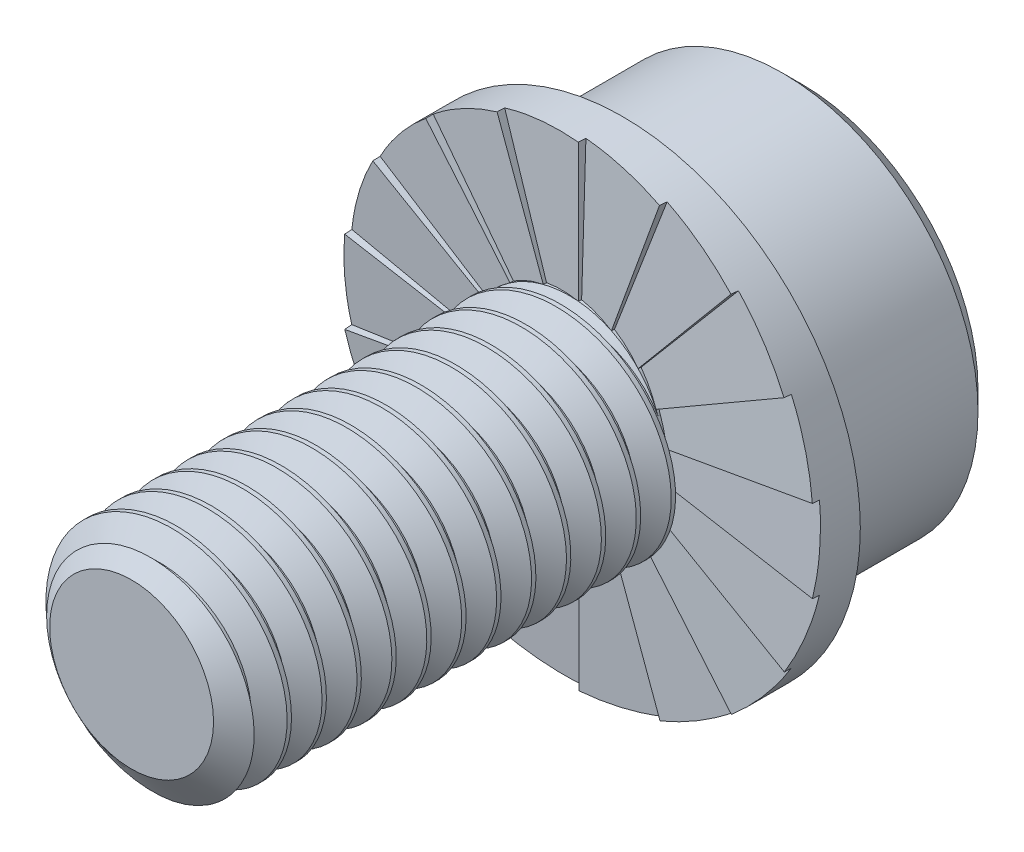
from build123d import *

# Parameters (mm, degrees)
SKETCH1_R           = 4
EXTRUDE1_DEPTH      = 16
CUT_SWEEP1_PITCH    = 1.25
SKETCH6_R           = 7
EXTRUDE2_DEPTH      = 8
SKETCH10_R          = 8.5
BOSS_EXTRUDE1_DEPTH = 1.5875
CUT_EXTRUDE5_DEPTH  = 1.5875
CIRPATTERN1_COUNT   = 18
BOSS_EXTRUDE2_REACH = 22.012
CUT_EXTRUDE1_DEPTH  = 4.5
CHAMFER1_SIZE       = 0.7
FILLET1_R           = 0.396875


with BuildPart() as part:
    # Sketch1 → Extrude1 (new body)
    with BuildSketch(Plane.XY):
        Circle(SKETCH1_R)
    extrude(amount=-EXTRUDE1_DEPTH)

    # Cut-Sweep1: arcs per turn and ends read off the stored shape
    # Cut-Sweep1: the profile of Sketch3 profile screwed along a right-hand helix through 15 turns, 6 arcs to a turn; built about Z, then put on its axis
    cut_sweep1_z = Axis((0, 0, 0), (0, 0, 1))
    cut_sweep1_corners = [(4.0003, 0, -2.343923205), (3.188101184, 0, -1.875), (3.188101184, 0, -1.71875), (4.0003, 0, -1.249826795)]
    with BuildLine(mode=Mode.PRIVATE) as cut_sweep1_profile:
        Line(cut_sweep1_corners[0], cut_sweep1_corners[1])
        Line(cut_sweep1_corners[1], cut_sweep1_corners[2])
        Line(cut_sweep1_corners[2], cut_sweep1_corners[3])
        Line(cut_sweep1_corners[3], cut_sweep1_corners[0])
    cut_sweep1_cap = Face(cut_sweep1_profile.wire())
    cut_sweep1_turn_angles = [0, 30, 60, 90, 120, 150, 180, 210, 240, 270, 300, 330, 360]
    cut_sweep1_turn_weights = [1, 0.8660254037844387, 1, 0.8660254037844387, 1, 0.8660254037844387, 1, 0.8660254037844387, 1, 0.8660254037844387, 1, 0.8660254037844387, 1]
    cut_sweep1_turn_rails = [Edge.make_bspline([Vector(p[0], p[1], 0).rotate(cut_sweep1_z, cut_sweep1_turn_angles[k]) / cut_sweep1_turn_weights[k] + Vector(0, 0, p[2] + CUT_SWEEP1_PITCH * cut_sweep1_turn_angles[k] / 360) for k in range(13)], [0, 0, 0, 1, 1, 2, 2, 3, 3, 4, 4, 5, 5, 6, 6, 6], 2, cut_sweep1_turn_weights) for p in cut_sweep1_corners]
    cut_sweep1_turn_sides = [Face.make_surface_from_curves(cut_sweep1_turn_rails[p[0]], cut_sweep1_turn_rails[p[1]]) for p in [(0, 1), (1, 2), (2, 3), (3, 0)]]
    cut_sweep1 = Plane(origin=(0, 0, 0), x_dir=(0, 1, 0), z_dir=(0, 0, -1)) * Solid(Shell([*[p.moved(Location((0, 0, CUT_SWEEP1_PITCH * i))) for i in range(15) for p in cut_sweep1_turn_sides], cut_sweep1_cap, cut_sweep1_cap.rotate(cut_sweep1_z, 5400).moved(Location((0, 0, CUT_SWEEP1_PITCH * 5400 / 360)))]))
    add(cut_sweep1, mode=Mode.SUBTRACT)

    # Sketch4 → Cut-Revolve1 (revolve, cut)
    with BuildSketch(Plane(origin=(0, 0, 0), x_dir=(0, 0, -1), z_dir=(1, 0, 0)), mode=Mode.PRIVATE) as cut_revolve1_sk:
        Polygon((0.746350386, 4), (0, 2.934101184), (0, 4), align=None)
    revolve(cut_revolve1_sk.sketch.rotate(Axis((0, 0, 0), (0, 0, -1)), 230.713364492), axis=Axis((0, 0, 0), (0, 0, -1)), mode=Mode.SUBTRACT)


with BuildPart() as body_2:
    # Sketch6 → Extrude2 (new body)
    with BuildSketch(Plane(origin=(0, 0, -16), x_dir=(-1, 0, 0), z_dir=(0, 0, -1))):
        Circle(SKETCH6_R)
    extrude(amount=EXTRUDE2_DEPTH)

    # Sketch10 → Boss-Extrude1 (add)
    with BuildSketch(Plane.XY.offset(-16)):
        Circle(SKETCH10_R)
    extrude(amount=-BOSS_EXTRUDE1_DEPTH)

    # Sketch19 → Cut-Extrude5 (cut)
    with BuildSketch(Plane(origin=(1.389185421, 0, -15.878462024), x_dir=(-0.996194698091745, 0, -0.08715574274766483), z_dir=(0.08715574274766483, 0, -0.996194698091745))):
        with BuildLine():
            Line((1.394491884, 0), (1.394491884, 11.040000007))
            add(Edge.make_bspline(
                [(5.169116445, 10.370695747), (4.642516462, 10.563598892), (4.104236344, 10.715035313), (2.848427134, 10.967069667), (2.117821205, 11.039743484), (1.397093721, 11.039999769), (1.395792795, 11.040000002), (1.394491884, 11.040000007)],
                knots=[0.444410142, 0.444410142, 0.444410142, 0.444410142, 0.46875, 0.46875, 0.5, 0.5, 0.500056509, 0.500056509, 0.500056509, 0.500056509], degree=3))
            Line((5.169116445, 10.370695747), (1.394491884, 0))
        make_face()
    cut_extrude5 = extrude(amount=-CUT_EXTRUDE5_DEPTH, mode=Mode.SUBTRACT)

    # CirPattern1: Cut-Extrude5 ×18 about axis
    cirpattern1_axis = Axis((0, 0, 0), (0, 0, 1))
    for i in range(1, CIRPATTERN1_COUNT):
        add(cut_extrude5.rotate(cirpattern1_axis, i * 360 / CIRPATTERN1_COUNT), mode=Mode.SUBTRACT)

    # Sketch20 → Boss-Extrude2 (add, up to next)
    with BuildSketch(Plane(origin=(0, 0, -16), x_dir=(-1, 0, 0), z_dir=(0, 0, -1)), mode=Mode.PRIVATE) as boss_extrude2_sk1:
        with BuildLine():
            ThreePointArc((-2.847065393, 1.434645533), (-3.177638958, 0.258069391), (-3.041254697, -0.956430355))
            add(Edge.make_bspline(
                [(-3.041254697, -0.956430355), (-2.970730657, -1.309523255), (-2.83931932, -1.640576819), (-2.474300515, -2.259017385), (-2.247579389, -2.534060866), (-1.710186248, -3.010190699), (-1.411500975, -3.201151408), (-0.754363806, -3.489195493), (-0.409717001, -3.579654897), (0.123707929, -3.634193731), (0.303842484, -3.639264675), (0.659211651, -3.624674227), (0.835785829, -3.604956129), (1.18669023, -3.540415306), (1.361621829, -3.495195087), (1.698890222, -3.382061839), (1.862514853, -3.314013764), (2.338473945, -3.075686223), (2.637192273, -2.86883457), (3.157505818, -2.38753983), (3.385122083, -2.106949834), (3.57211422, -1.8)],
                knots=[0, 0, 0, 0, 0.125, 0.125, 0.25, 0.25, 0.375, 0.375, 0.5, 0.5, 0.5625, 0.5625, 0.625, 0.625, 0.6875, 0.6875, 0.75, 0.75, 0.875, 0.875, 1, 1, 1, 1], degree=3))
            ThreePointArc((3.57211422, -1.8), (3.986873408, -0.323790715), (3.815756806, 1.2))
            add(Edge.make_bspline(
                [(3.815756806, 1.2), (3.678901358, 1.532429411), (3.503018702, 1.840471554), (3.177426395, 2.263937058), (3.057060422, 2.399221208), (2.801579734, 2.647845975), (2.66603619, 2.762054601), (2.236396381, 3.074887675), (1.914361266, 3.245148023), (1.4127593, 3.424055232), (1.241721069, 3.471673608), (0.891845206, 3.542486547), (0.712341619, 3.565505878), (0.356835675, 3.585368209), (0.17946694, 3.582590695), (-0.174508054, 3.551816681), (-0.352606652, 3.522119481), (-0.873898906, 3.391571193), (-1.200098871, 3.252587101), (-1.809137602, 2.868998374), (-2.07677962, 2.633562183), (-2.419742758, 2.218722745), (-2.523122594, 2.070988079), (-2.703861491, 1.763473952), (-2.782510923, 1.603061662), (-2.847065393, 1.434645533)],
                knots=[0, 0, 0, 0, 0.125, 0.125, 0.1875, 0.1875, 0.25, 0.25, 0.375, 0.375, 0.4375, 0.4375, 0.5, 0.5, 0.5625, 0.5625, 0.625, 0.625, 0.75, 0.75, 0.875, 0.875, 0.9375, 0.9375, 1, 1, 1, 1], degree=3))
        make_face()
    boss_extrude2_tool1 = extrude(boss_extrude2_sk1.sketch, amount=BOSS_EXTRUDE2_REACH, mode=Mode.PRIVATE) - body_2.part

    add(part.part)  # Boss-Extrude2 merges part
    add(boss_extrude2_tool1.solids().sort_by_distance((-0.40323, -0.03184, -16))[0])

    # Sketch7 → Cut-Extrude1 (cut)
    with BuildSketch(Plane(origin=(0, 0, -24), x_dir=(-1, 0, 0), z_dir=(0, 0, -1))):
        Polygon((0, 3.464101615), (-3, 1.732050808), (-3, -1.732050808), (0, -3.464101615), (3, -1.732050808), (3, 1.732050808), align=None)
    extrude(amount=-CUT_EXTRUDE1_DEPTH, mode=Mode.SUBTRACT)

    # Cut-Extrude2 cone 1 section (through the dimple's axis) → Cut-Extrude2 (revolve, cut)
    with BuildSketch(Plane(origin=(0, 0, -24), x_dir=(0, 1, 0), z_dir=(1, 0, 0))):
        Polygon((0, 0), (3.464101615, 0), (0, 3.464101615), align=None)
    revolve(axis=Axis((0, 0, -24), (0, 0, 1)), mode=Mode.SUBTRACT)

    # Chamfer1
    chamfer1_edges = [body_2.edges().sort_by_distance(p)[0] for p in [
        (7, 0, -24),
    ]]
    chamfer(chamfer1_edges, length=CHAMFER1_SIZE)

    # Fillet1
    fillet1_edges = [body_2.edges().sort_by_distance(p)[0] for p in [
        (7, 0, -17.5875),
    ]]
    fillet(fillet1_edges, radius=FILLET1_R)


solid = body_2.part
